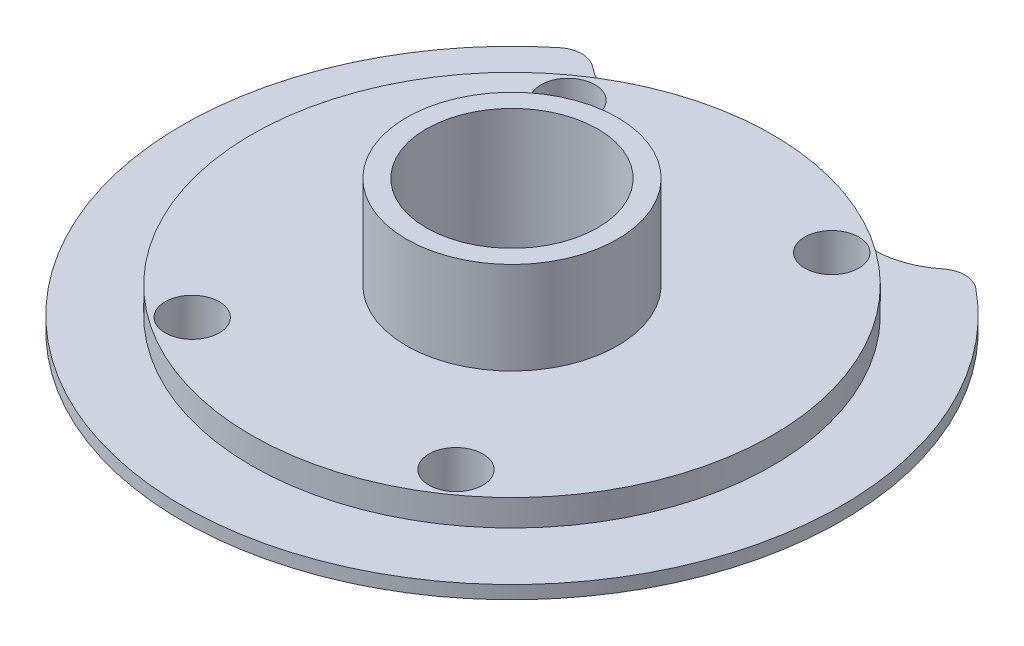
from build123d import *

# Parameters (mm, degrees)
SKETCH1_R           = 12.5
BOSS_EXTRUDE1_DEPTH = 1.5
SKETCH2_R           = 3.25
CUT_EXTRUDE1_DEPTH  = 18.741194999
SKETCH3_R           = 4
SKETCH3_R_2         = 3.25
BOSS_EXTRUDE2_DEPTH = 3.5
CUT_EXTRUDE2_START  = -1
SKETCH4_R           = 12.5
SKETCH4_R_2         = 9.875
CUT_EXTRUDE2_DEPTH  = 1
CUT_EXTRUDE3_DEPTH  = 19.241436347
FILLET1_R           = 3.125
FILLET2_R           = 1
SKETCH6_R           = 1.025
CUT_EXTRUDE4_DEPTH  = 19.371173207


with BuildPart() as part:
    # Sketch1 → Boss-Extrude1 (new body)
    with BuildSketch(Plane(origin=(0, 0, 0), x_dir=(1, 0, 0), z_dir=(0, 1, 0))):
        with Locations(Location((0, 0, 0), (0, 0, 270))):
            Circle(SKETCH1_R)
    extrude(amount=BOSS_EXTRUDE1_DEPTH)

    # Sketch2 → Cut-Extrude1 (cut, through all)
    with BuildSketch(Plane.XZ):
        with Locations(Location((0, 0, 0), (0, 0, 270))):
            Circle(SKETCH2_R)
    extrude(amount=-CUT_EXTRUDE1_DEPTH, mode=Mode.SUBTRACT)

    # Sketch3 → Boss-Extrude2 (add)
    with BuildSketch(Plane(origin=(0, 1.5, 0), x_dir=(1, 0, 0), z_dir=(0, 1, 0))):
        with Locations(Location((0, 0, 0), (0, 0, 270))):
            Circle(SKETCH3_R)
        with Locations(Location((0, 0, 0), (0, 0, 90))):
            Circle(SKETCH3_R_2, mode=Mode.SUBTRACT)
    extrude(amount=BOSS_EXTRUDE2_DEPTH)

    # Sketch4 → Cut-Extrude2 (cut)
    with BuildSketch(Plane(origin=(0, 1.5, 0), x_dir=(1, 0, 0), z_dir=(0, 1, 0)).offset(CUT_EXTRUDE2_START)):
        with Locations(Location((0, 0, 0), (0, 0, 270))):
            Circle(SKETCH4_R)
        with Locations(Location((0, 0, 0), (0, 0, 270))):
            Circle(SKETCH4_R_2, mode=Mode.SUBTRACT)
    extrude(amount=CUT_EXTRUDE2_DEPTH, mode=Mode.SUBTRACT)

    # Sketch5 → Cut-Extrude3 (cut, through all)
    with BuildSketch(Plane(origin=(0, 0.5, 0), x_dir=(1, 0, 0), z_dir=(0, 1, 0))):
        with BuildLine():
            ThreePointArc((0, 9.875), (2.96946977, 9.417954889), (5.664067309, 8.089126437))
            Line((5.664067309, 8.089126437), (7.169705454, 10.239400554))
            ThreePointArc((7.169705454, 10.239400554), (3.758822494, 11.921461884), (0, 12.5))
            Line((0, 12.5), (0, 9.875))
        make_face()
        with BuildLine():
            ThreePointArc((-5.664067309, 8.089126437), (-2.96946977, 9.417954889), (0, 9.875))
            Line((0, 9.875), (0, 12.5))
            ThreePointArc((0, 12.5), (-3.758822494, 11.921461884), (-7.169705454, 10.239400554))
            Line((-7.169705454, 10.239400554), (-5.664067309, 8.089126437))
        make_face()
    extrude(amount=-CUT_EXTRUDE3_DEPTH, mode=Mode.SUBTRACT)

    # Fillet1
    # the kernel refuses this fillet: 3.125 mm, written as the material it adds along each edge
    with BuildSketch(Plane(origin=(-5.664067309, 0.5, -8.089126437), x_dir=(-0.5735764363510301, 0, -0.819152044289003), z_dir=(0, -1, 0))) as fillet1_piece_1:
        with BuildLine():
            CenterArc((2.744375, 3.122719105), FILLET1_R, 193.898885593, 73.911882973)
            Line((-0.289128606, 2.372065474), (-0.349798678, 2.357052401))
            ThreePointArc((-0.349798678, 2.357052401), (-0.134589479, 1.187248558), (-0.0625, 0))
            Line((-0.0625, 0), (0, -0.0625))
            ThreePointArc((0, -0.0625), (1.3125, -0.0625), (2.6226125, -0.062454382))
            Line((2.6226125, -0.062454382), (2.625, 0))
        make_face()
    extrude(amount=0.5)
    with BuildSketch(Plane(origin=(5.664067309, 0.5, -8.089126437), x_dir=(-0.8825329923236406, 0, -0.4702504837427398), z_dir=(0, -1, 0))) as fillet1_piece_2:
        with BuildLine():
            CenterArc((2.767725938, 3.102041567), FILLET1_R, 189.13867423, 73.911882973)
            Line((-0.317607894, 2.605714916), (-0.379314571, 2.595788383))
            ThreePointArc((-0.379314571, 2.595788383), (-0.220844779, 1.295295365), (-0.062040831, -0.007562093))
            Line((-0.062040831, -0.007562093), (0.007562093, -0.062040831))
            ThreePointArc((0.007562093, -0.062040831), (1.194810651, 0.010048648), (2.382059209, -0.062040831))
            Line((2.382059209, -0.062040831), (2.389621301, 0))
        make_face()
    extrude(amount=0.5)

    # Fillet2
    fillet2_edges = [part.edges().sort_by_distance(p)[0] for p in [
        (-7.169705454, 0.25, -10.239400554),
        (7.169705454, 0.25, -10.239400554),
    ]]
    fillet(fillet2_edges, radius=FILLET2_R)

    # Sketch6 → Cut-Extrude4 (cut, through all)
    with BuildSketch(Plane.XZ):
        with Locations(Location((-5, 7.125, 0), (0, 0, 270))):
            Circle(SKETCH6_R)
        with Locations(Location((5, 7.125, 0), (0, 0, 270))):
            Circle(SKETCH6_R)
        with Locations(Location((5, -7.125, 0), (0, 0, 270))):
            Circle(SKETCH6_R)
        with Locations(Location((-5, -7.125, 0), (0, 0, 270))):
            Circle(SKETCH6_R)
    extrude(amount=-CUT_EXTRUDE4_DEPTH, mode=Mode.SUBTRACT)


solid = part.part
